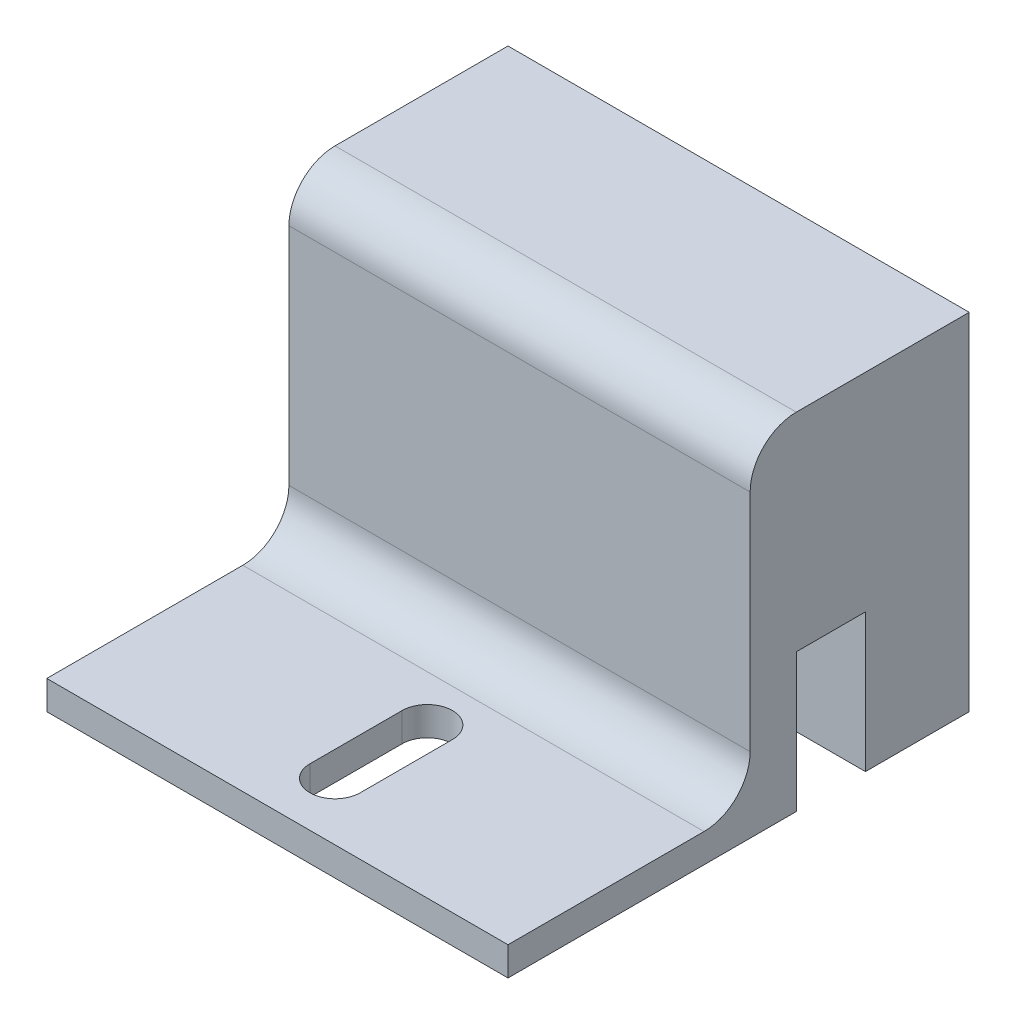
from build123d import *

# Parameters (mm, degrees)
BOSS_EXTRUDE1_DEPTH = 50.8
CUT_EXTRUDE1_DEPTH  = 80.881384721
FILLET1_R           = 5.08


with BuildPart() as part:
    # Sketch1 → Boss-Extrude1 (new body)
    with BuildSketch(Plane(origin=(0, 0, 0), x_dir=(0, 0, -1), z_dir=(1, 0, 0))):
        Polygon((0, 0), (-11.43, 0), (-11.43, 15.24), (-19.05, 15.24), (-19.05, 0), (-50.8, 0), (-50.8, 3.175), (-24.13, 3.175), (-24.13, 38.1), (0, 38.1), align=None)
    extrude(amount=BOSS_EXTRUDE1_DEPTH)

    # Sketch2 → Cut-Extrude1 (cut, through all)
    with BuildSketch(Plane(origin=(0, 3.175, 0), x_dir=(1, 0, 0), z_dir=(0, 1, 0))):
        with BuildLine():
            Line((28.1686, -34.29), (28.1686, -44.45))
            ThreePointArc((28.1686, -44.45), (25.4, -47.2186), (22.6314, -44.45))
            Line((22.6314, -44.45), (22.6314, -34.29))
            ThreePointArc((22.6314, -34.29), (25.4, -31.5214), (28.1686, -34.29))
        make_face()
    extrude(amount=-CUT_EXTRUDE1_DEPTH, mode=Mode.SUBTRACT)

    # Fillet1
    fillet1_edges = [part.edges().sort_by_distance(p)[0] for p in [
        (25.4, 38.1, 24.13),
        (25.4, 3.175, 24.13),
    ]]
    fillet(fillet1_edges, radius=FILLET1_R)


solid = part.part
